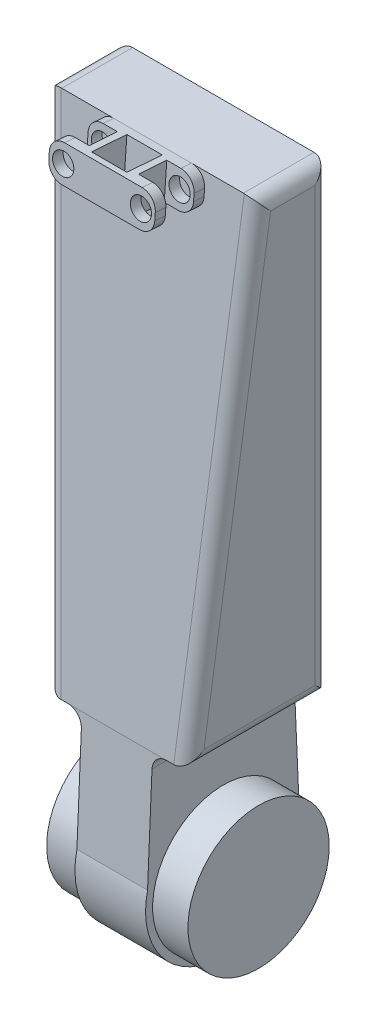
from build123d import *

# Parameters (mm, degrees)
SALIENTE_EXTRUIR1_DEPTH = 5
CROQUIS5_R              = 10
SALIENTE_EXTRUIR2_DEPTH = 10
CROQUIS6_R              = 1.5
SALIENTE_EXTRUIR3_DEPTH = 7
CROQUIS7_W              = 4
CROQUIS7_H              = 4
CORTAR_EXTRUIR1_DEPTH   = 5
REDONDEO1_R             = 2
CROQUIS8_W              = 5
CROQUIS8_H              = 5
CORTAR_EXTRUIR2_DEPTH   = 10


with BuildPart() as part:
    # Croquis2 → Recubrir1 section 0
    with BuildSketch(Plane(origin=(0, 70, 0), x_dir=(1, 0, 0), z_dir=(0, 1, 0))):
        with BuildLine():
            Line((15, -5), (-15, -5))
            Line((-15, -5), (-15, 5))
            Line((-15, 5), (15, 5))
            Line((15, 5), (15, -5))
        make_face()
    # Croquis1 → Recubrir1 section 1
    with BuildSketch(Plane(origin=(0, 0, 0), x_dir=(1, 0, 0), z_dir=(0, 1, 0))):
        with BuildLine():
            Line((10, -10), (-10, -10))
            Line((-10, -10), (-10, 10))
            Line((-10, 10), (10, 10))
            Line((10, 10), (10, -10))
        make_face()
    loft()

    # Croquis4 → Saliente-Extruir1 (add, symmetric)
    with BuildSketch(Plane(origin=(0, 0, 0), x_dir=(0, 0, -1), z_dir=(1, 0, 0))):
        with BuildLine():
            Line((-10, 0), (-10.71921501, -16.530500138))
            ThreePointArc((-10.71921501, -16.530500138), (0, -30), (10.71921501, -16.530500138))
            Line((10.71921501, -16.530500138), (10, 0))
            Line((10, 0), (-10, 0))
        make_face()
    extrude(amount=SALIENTE_EXTRUIR1_DEPTH, both=True)

    # Croquis5 → Saliente-Extruir2 (add, symmetric)
    with BuildSketch(Plane(origin=(0, 0, 0), x_dir=(0, 0, -1), z_dir=(1, 0, 0))):
        with Locations((0, -19)):
            Circle(CROQUIS5_R)
    extrude(amount=SALIENTE_EXTRUIR2_DEPTH, both=True)

    # Croquis6 → Saliente-Extruir3 (add)
    with BuildSketch(Plane(origin=(0, 0.710659898, 9.949238579), x_dir=(1, 0, 0), z_dir=(0, 0.07124704998790965, 0.997458699830735))):
        with BuildLine():
            Line((-5.5, 64.465873738), (5.5, 64.465873738))
            ThreePointArc((5.5, 64.465873738), (6.914213562, 65.051660176), (7.5, 66.465873738))
            Line((7.5, 66.465873738), (7.5, 67.465873738))
            ThreePointArc((7.5, 67.465873738), (6.914213562, 68.880087301), (5.5, 69.465873738))
            Line((5.5, 69.465873738), (-5.5, 69.465873738))
            ThreePointArc((-5.5, 69.465873738), (-6.914213562, 68.880087301), (-7.5, 67.465873738))
            Line((-7.5, 67.465873738), (-7.5, 66.465873738))
            ThreePointArc((-7.5, 66.465873738), (-6.914213562, 65.051660176), (-5.5, 64.465873738))
        make_face()
        with Locations(Location((-5.5, 66.965873738, 0), (0, 0, 90))):
            Circle(CROQUIS6_R, mode=Mode.SUBTRACT)
        with Locations(Location((5.5, 66.965873738, 0), (0, 0, 90))):
            Circle(CROQUIS6_R, mode=Mode.SUBTRACT)
    extrude(amount=SALIENTE_EXTRUIR3_DEPTH)

    # Croquis7 → Cortar-Extruir1 (cut, symmetric)
    with BuildSketch(Plane(origin=(0, 69.289340102, -4.949238579), x_dir=(1, 0, 0), z_dir=(0, 0.997458699830735, -0.07124704998790966))):
        with Locations((-5.5, -13.474586998)):
            Rectangle(CROQUIS7_W, CROQUIS7_H)
        with Locations((5.5, -13.474586998)):
            Rectangle(CROQUIS7_W, CROQUIS7_H)
    extrude(amount=CORTAR_EXTRUIR1_DEPTH, both=True, mode=Mode.SUBTRACT)

    # Redondeo1
    # the kernel refuses this fillet: 2 mm, written as the material it adds along each edge
    with BuildSketch(Plane(origin=(-5, 0, -15), x_dir=(-1, 0, 0), z_dir=(0, 0, 1))) as redondeo1_piece_1_section:
        with BuildLine():
            CenterArc((REDONDEO1_R, REDONDEO1_R), REDONDEO1_R, 180, 90)
            Line((0, REDONDEO1_R), (0, 0))
            Line((0, 0), (REDONDEO1_R, 0))
        make_face()
    redondeo1_piece_1 = extrude(amount=30, mode=Mode.PRIVATE)
    redondeo1_piece_1 = split(redondeo1_piece_1, bisect_by=Plane(origin=(-5.45231098, -0.018481015, 10.000804079), z_dir=(0, -0.043467241760335076, -0.999054852795255)), keep=Keep.TOP, mode=Mode.PRIVATE)
    redondeo1_piece_1 = split(redondeo1_piece_1, bisect_by=Plane(origin=(-5.45231098, -0.018481001, -10.000804078), z_dir=(0, -0.04346724176032877, 0.9990548527952553)), keep=Keep.TOP, mode=Mode.PRIVATE)
    add(redondeo1_piece_1)
    with BuildSketch(Plane(origin=(5, 0, -15), x_dir=(1, 0, 0), z_dir=(0, 0, 1))) as redondeo1_piece_2_section:
        with BuildLine():
            CenterArc((REDONDEO1_R, -REDONDEO1_R), REDONDEO1_R, 90, 90)
            Line((0, -REDONDEO1_R), (0, 0))
            Line((0, 0), (REDONDEO1_R, 0))
        make_face()
    redondeo1_piece_2 = extrude(amount=30, mode=Mode.PRIVATE)
    redondeo1_piece_2 = split(redondeo1_piece_2, bisect_by=Plane(origin=(5.45231098, -0.018481001, 10.000804078), z_dir=(0, -0.043467241760335076, -0.999054852795255)), keep=Keep.TOP, mode=Mode.PRIVATE)
    redondeo1_piece_2 = split(redondeo1_piece_2, bisect_by=Plane(origin=(5.45231098, -0.018481015, -10.000804079), z_dir=(0, -0.04346724176032877, 0.9990548527952553)), keep=Keep.TOP, mode=Mode.PRIVATE)
    add(redondeo1_piece_2)
    # the kernel refuses this fillet: 2 mm, written as the material it takes off along each edge
    with BuildSketch(Plane(origin=(15, 70, -10.369881731), x_dir=(-1, 0, 0), z_dir=(0, 0, 1))) as redondeo1_2_piece_1:
        with BuildLine():
            CenterArc((REDONDEO1_R * 1.07397634626, REDONDEO1_R), REDONDEO1_R, 175.91438322, 94.08561678)
            Line((REDONDEO1_R * 0.0765176464277, REDONDEO1_R * 1.07124704999), (0, 0))
            Line((0, 0), (REDONDEO1_R * 1.07397634626, 0))
        make_face()
    extrude(amount=20.739763463, mode=Mode.SUBTRACT)
    with BuildSketch(Plane(origin=(15.357142857, 75, -4.642857143), x_dir=(-0.9974715509474419, 0.07088630311301622, 0.00506330736521557), z_dir=(-0.07106690545187021, -0.9949366763261821, -0.07106690545187017)), Plane(origin=(-15.357142857, 75, 4.642857143), x_dir=(0.9974715509474419, 0.07088630311301611, -0.005063307365215563), z_dir=(0.0710669054518701, -0.9949366763261821, 0.07106690545187014))) as redondeo1_2_piece_2:
        with BuildLine():
            CenterArc((REDONDEO1_R * 1.00508909139, -REDONDEO1_R), REDONDEO1_R, 90, 90.290842769)
            Line((REDONDEO1_R * 0.0051019750832, -REDONDEO1_R * 1.00507614213), (0, 0))
            Line((0, 0), (REDONDEO1_R * 1.00508909139, 0))
        make_face()
    extrude(amount=80.407127311, mode=Mode.SUBTRACT)
    with BuildSketch(Plane(origin=(10, 0, -14.655596017), x_dir=(-1, 0, 0), z_dir=(0, 0, 1)), Plane(origin=(-10, 0, 14.655596017), x_dir=(1, 0, 0), z_dir=(0, 0, -1))) as redondeo1_2_piece_3:
        with BuildLine():
            CenterArc((REDONDEO1_R * 0.931119203401, -REDONDEO1_R), REDONDEO1_R, 90, 85.91438322)
            Line((-REDONDEO1_R * 0.0663394964294, -REDONDEO1_R * 0.928752950012), (0, 0))
            Line((0, 0), (REDONDEO1_R * 0.931119203401, 0))
        make_face()
    extrude(amount=29.311192034, mode=Mode.SUBTRACT)
    with BuildSketch(Plane(origin=(15.357142857, 75, 4.642857143), x_dir=(-0.9974715509474419, 0.07088630311301623, -0.005063307365215571), z_dir=(-0.07106690545187021, -0.9949366763261821, 0.07106690545187014)), Plane(origin=(-15.357142857, 75, -4.642857143), x_dir=(0.9974715509474419, 0.07088630311301615, 0.005063307365215123), z_dir=(0.0710669054518701, -0.9949366763261821, -0.07106690545187017))) as redondeo1_2_piece_4:
        with BuildLine():
            CenterArc((REDONDEO1_R * 1.00508909139, REDONDEO1_R), REDONDEO1_R, 179.709157231, 90.290842769)
            Line((REDONDEO1_R * 0.0051019750832, REDONDEO1_R * 1.00507614213), (0, 0))
            Line((0, 0), (REDONDEO1_R * 1.00508909139, 0))
        make_face()
    extrude(amount=80.407127311, mode=Mode.SUBTRACT)
    with BuildSketch(Plane(origin=(-15, 70, 10.369881731), x_dir=(0.07124704998790952, -0.997458699830735, 0), z_dir=(0, 0, -1))) as redondeo1_2_piece_5:
        with BuildLine():
            CenterArc((REDONDEO1_R * 1.07397634626, -REDONDEO1_R), REDONDEO1_R, 90, 94.08561678)
            Line((REDONDEO1_R * 0.0765176464277, -REDONDEO1_R * 1.07124704999), (0, 0))
            Line((0, 0), (REDONDEO1_R * 1.07397634626, 0))
        make_face()
    extrude(amount=20.739763463, mode=Mode.SUBTRACT)

    # Croquis8 → Cortar-Extruir2 (cut)
    with BuildSketch(Plane(origin=(0, 69.289340102, -4.949238579), x_dir=(1, 0, 0), z_dir=(0, 0.997458699830735, -0.07124704998790966))):
        with Locations((0, -13.621474852)):
            Rectangle(CROQUIS8_W, CROQUIS8_H)
    extrude(amount=-CORTAR_EXTRUIR2_DEPTH, mode=Mode.SUBTRACT)


solid = part.part
